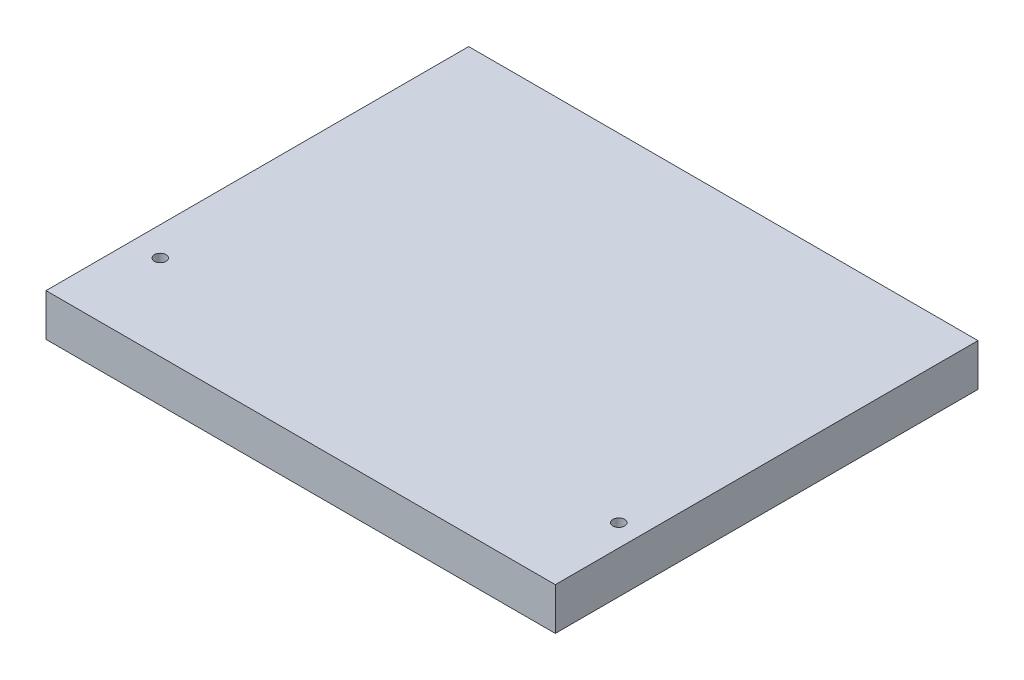
from build123d import *

# Parameters (mm, degrees)
SKETCH1_W           = 306.04968
SKETCH1_H           = 25.4
BOSS_EXTRUDE1_DEPTH = 254
SKETCH3_R           = 3.5
CUT_EXTRUDE1_DEPTH  = 298.620163391


with BuildPart() as part:
    # Sketch1 → Boss-Extrude1 (new body)
    with BuildSketch(Plane.XY):
        Rectangle(SKETCH1_W, SKETCH1_H)
    extrude(amount=-BOSS_EXTRUDE1_DEPTH)

    # Sketch3 → Cut-Extrude1 (cut, through all)
    with BuildSketch(Plane(origin=(0, 12.7, 0), x_dir=(1, 0, 0), z_dir=(0, 1, 0))):
        with Locations((-135.665717903, 51.283410885)):
            Circle(SKETCH3_R)
        with Locations((139.861300832, 51.283410885)):
            Circle(SKETCH3_R)
    extrude(amount=-CUT_EXTRUDE1_DEPTH, mode=Mode.SUBTRACT)


solid = part.part
